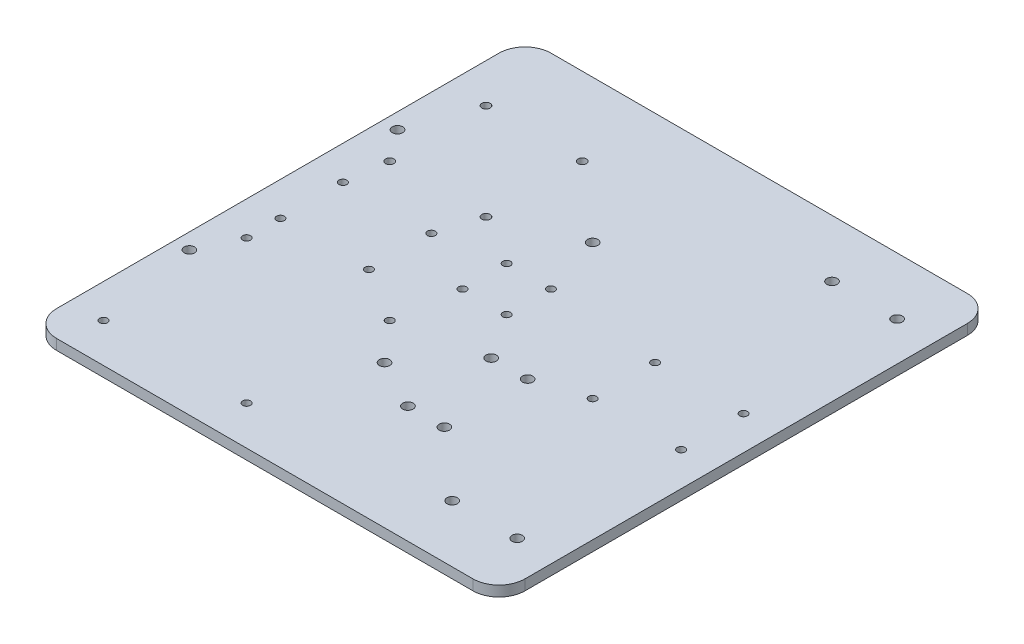
from build123d import *

# Parameters (mm, degrees)
SKETCH_1_W           = 180
SKETCH_1_H           = 190
EXTRUDE_1_DEPTH      = 4
SKETCH_4_R           = 1.6
CUT_EXTRUDE_3_DEPTH  = 4
SKETCH_5_R           = 1.5
CUT_EXTRUDE_4_DEPTH  = 4
SKETCH_7_R           = 2
CUT_EXTRUDE_5_DEPTH  = 10
SKETCH_8_R           = 1.5
CUT_EXTRUDE_6_DEPTH  = 10
SKETCH_11_R          = 1.5
CUT_EXTRUDE_8_DEPTH  = 4
SKETCH_12_R          = 2
CUT_EXTRUDE_9_DEPTH  = 4
SKETCH_15_R          = 2
CUT_EXTRUDE_10_DEPTH = 131.923641868
FILLET_2_R           = 10


with BuildPart() as part:
    # 草图1 → 凸台-拉伸1 (new body)
    with BuildSketch(Plane(origin=(0, 0, 0), x_dir=(1, 0, 0), z_dir=(0, 1, 0))):
        Rectangle(SKETCH_1_W, SKETCH_1_H)
    extrude(amount=EXTRUDE_1_DEPTH)

    # 草图4 → 切除-拉伸3 (cut)
    with BuildSketch(Plane(origin=(0, 4, 0), x_dir=(1, 0, 0), z_dir=(0, 1, 0))):
        with Locations((-75, 65)):
            Circle(SKETCH_4_R)
        with Locations((-38, 65)):
            Circle(SKETCH_4_R)
        with Locations((-38, 28)):
            Circle(SKETCH_4_R)
        with Locations((-75, 28)):
            Circle(SKETCH_4_R)
    extrude(amount=-CUT_EXTRUDE_3_DEPTH, mode=Mode.SUBTRACT)

    # 草图5 → 切除-拉伸4 (cut)
    with BuildSketch(Plane(origin=(0, 4, 0), x_dir=(1, 0, 0), z_dir=(0, 1, 0))):
        with Locations((-77, -80)):
            Circle(SKETCH_5_R)
        with Locations((-77, -25)):
            Circle(SKETCH_5_R)
        with Locations((-22, -25)):
            Circle(SKETCH_5_R)
        with Locations((-22, -80)):
            Circle(SKETCH_5_R)
    extrude(amount=-CUT_EXTRUDE_4_DEPTH, mode=Mode.SUBTRACT)

    # 草图7 → 切除-拉伸5 (cut)
    with BuildSketch(Plane.XZ):
        with Locations((24, 50)):
            Circle(SKETCH_7_R)
        with Locations((10, 50)):
            Circle(SKETCH_7_R)
        with Locations((24, 18)):
            Circle(SKETCH_7_R)
        with Locations((10, 18)):
            Circle(SKETCH_7_R)
    extrude(amount=-CUT_EXTRUDE_5_DEPTH, mode=Mode.SUBTRACT)

    # 草图8 → 切除-拉伸6 (cut)
    with BuildSketch(Plane.XZ):
        with Locations((-18.5, 0.55)):
            Circle(SKETCH_8_R)
        with Locations((-1.5, 0.55)):
            Circle(SKETCH_8_R)
        with Locations((-18.5, -16.45)):
            Circle(SKETCH_8_R)
        with Locations((-1.5, -16.45)):
            Circle(SKETCH_8_R)
    extrude(amount=-CUT_EXTRUDE_6_DEPTH, mode=Mode.SUBTRACT)

    # 草图11 → 切除-拉伸8 (cut)
    with BuildSketch(Plane.XZ):
        with Locations((77, 12)):
            Circle(SKETCH_11_R)
        with Locations((43, 12)):
            Circle(SKETCH_11_R)
        with Locations((77, -12)):
            Circle(SKETCH_11_R)
        with Locations((43, -12)):
            Circle(SKETCH_11_R)
    cut_extrude_8 = extrude(amount=-CUT_EXTRUDE_8_DEPTH, mode=Mode.SUBTRACT)

    # 草图12 → 切除-拉伸9 (cut)
    with BuildSketch(Plane.XZ):
        with Locations((-84, 40)):
            Circle(SKETCH_12_R)
        with Locations((-9, 40)):
            Circle(SKETCH_12_R)
        with Locations((-9, -40)):
            Circle(SKETCH_12_R)
        with Locations((-84, -40)):
            Circle(SKETCH_12_R)
    extrude(amount=-CUT_EXTRUDE_9_DEPTH, mode=Mode.SUBTRACT)

    # 草图15 → 切除-拉伸10 (cut, through all)
    with BuildSketch(Plane(origin=(0, 4, 0), x_dir=(1, 0, 0), z_dir=(0, 1, 0))):
        with Locations((75, -73)):
            Circle(SKETCH_15_R)
        with Locations((50, -73)):
            Circle(SKETCH_15_R)
    cut_extrude_10 = extrude(amount=-CUT_EXTRUDE_10_DEPTH, mode=Mode.SUBTRACT)

    # 镜向2: 切除-拉伸10 across plane
    add(cut_extrude_10.mirror(Plane.XY), mode=Mode.SUBTRACT)

    # 圆角2
    fillet_2_edges = [part.edges().sort_by_distance(p)[0] for p in [
        (-90, 2, 95),
        (90, 2, 95),
        (90, 2, -95),
        (-90, 2, -95),
    ]]
    fillet(fillet_2_edges, radius=FILLET_2_R)

    # 镜向3: 切除-拉伸8 across plane
    add(cut_extrude_8.mirror(Plane(origin=(0, 0, 0), x_dir=(0, 0, 1), z_dir=(1, 0, 0))), mode=Mode.SUBTRACT)


solid = part.part
